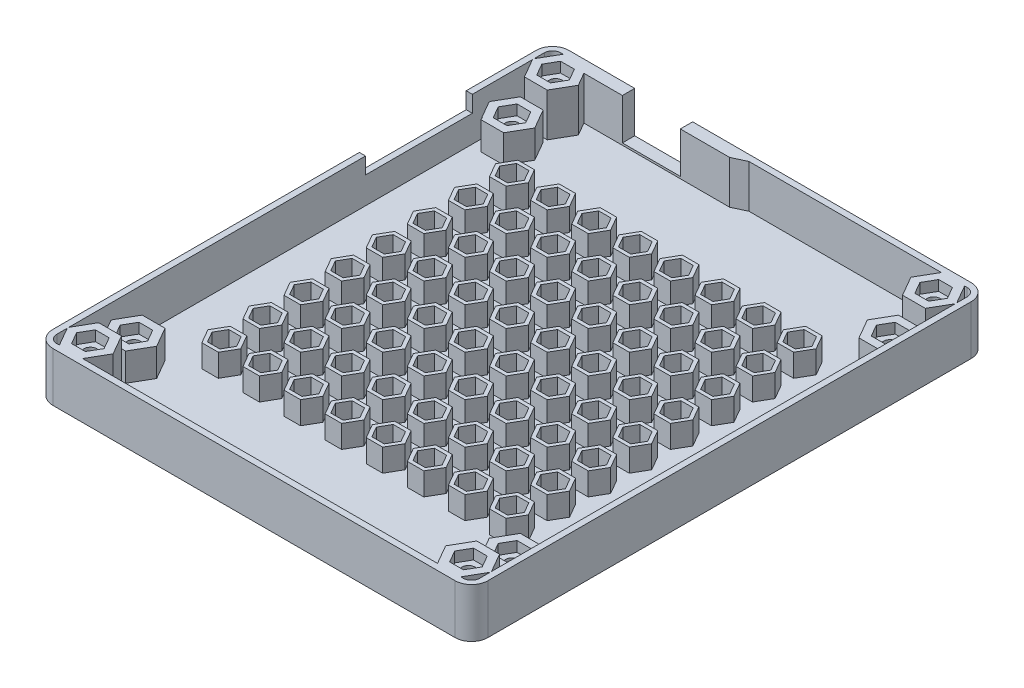
from build123d import *

# Parameters (mm, degrees)
P_IDAT_VYSUNUT_M25_DEPTH      = 3
P_IDAT_VYSUNUT_M26_DEPTH      = 10.5
P_IDAT_VYSUNUT_M26_DEPTH_BACK = 3
SKICA1_21_W                   = 105.885125168
SKICA1_21_H                   = 125.6
SKICA1_21_W_2                 = 102.885125168
SKICA1_21_H_2                 = 122.6
P_IDAT_VYSUNUT_M28_DEPTH      = 6.8
SKICA1_24_R                   = 1.6
P_IDAT_VYSUNUT_M29_DEPTH      = 4.3
LINPOLE3_COUNT                = 2
LINPOLE3_PITCH                = 92
LINPOLE3_COUNT_DIR2           = 2
LINPOLE3_PITCH_DIR2           = 92
P_IDAT_VYSUNUT_M30_DEPTH      = 10.5
SKICA1_26_R                   = 1.6
P_IDAT_VYSUNUT_M31_DEPTH      = 8
LINPOLE4_COUNT                = 2
LINPOLE4_PITCH                = 92
LINPOLE4_COUNT_DIR2           = 2
LINPOLE4_PITCH_DIR2           = 113.2
ZAOBLIT4_R                    = 4
SKICA9_W                      = 26
SKICA9_H                      = 4
ODEBRAT_VYSUNUT_M1_DEPTH      = 4
SKICA10_W                     = 14.1
SKICA10_H                     = 10
ODEBRAT_VYSUNUT_M2_DEPTH      = 5
P_IDAT_VYSUNUT_M32_DEPTH      = 5.5
LINPOLE5_COUNT                = 8
LINPOLE5_PITCH                = 10
LINPOLE5_COUNT_DIR2           = 8
LINPOLE5_PITCH_DIR2           = 10
SKICA12_W                     = 134.755212012
SKICA12_H                     = 11.049060792
ODEBRAT_VYSUNUT_M3_DEPTH      = 124.554642697
ZAOBLIT5_R                    = 2
P_IDAT_VYSUNUT_M33_DEPTH      = 1.5
P_IDAT_VYSUNUT_M34_REACH      = 85.011


with BuildPart() as part:
    # Skica1 → Přidat vysunutím25 (new body)
    with BuildSketch(Plane(origin=(0, 0, 0), x_dir=(1, 0, 0), z_dir=(0, 1, 0))):
        Polygon((51.442562584, 61.3), (-43.170983681, 61.3), (-43.228718708, 61.4), (-48.771281292, 61.4), (-48.829016319, 61.3), (-51.442562584, 61.3), (-51.442562584, 56.773205081), (-51.542562584, 56.6), (-51.442562584, 56.426794919), (-51.442562584, 46.173205081), (-51.542562584, 46), (-51.442562584, 45.826794919), (-51.442562584, -61.3), (51.442562584, -61.3), align=None)
    extrude(amount=-P_IDAT_VYSUNUT_M25_DEPTH)

    # Skica1<21> → Přidat vysunutím26 (add, two sides: drawn at the far end of the back side and taken through both)
    with BuildSketch(Plane(origin=(0, 0, 0), x_dir=(1, 0, 0), z_dir=(0, 1, 0)).offset(-P_IDAT_VYSUNUT_M26_DEPTH_BACK)):
        Rectangle(SKICA1_21_W, SKICA1_21_H)
        Rectangle(SKICA1_21_W_2, SKICA1_21_H_2, mode=Mode.SUBTRACT)
    extrude(amount=P_IDAT_VYSUNUT_M26_DEPTH + P_IDAT_VYSUNUT_M26_DEPTH_BACK)

    # Skica1<23> → Přidat vysunutím28 (add)
    with BuildSketch(Plane(origin=(0, 0, 0), x_dir=(1, 0, 0), z_dir=(0, 1, 0))):
        Polygon((-48.771281292, 41.2), (-43.228718708, 41.2), (-40.457437416, 46), (-43.228718708, 50.8), (-48.771281292, 50.8), (-51.542562584, 46), align=None)
        Polygon((-44.325684219, 43.1), (-47.674315781, 43.1), (-49.348631561, 46), (-47.674315781, 48.9), (-44.325684219, 48.9), (-42.651368439, 46), align=None, mode=Mode.SUBTRACT)
    p_idat_vysunut_m28 = extrude(amount=P_IDAT_VYSUNUT_M28_DEPTH)

    # Skica1<24> → Přidat vysunutím29 (add)
    with BuildSketch(Plane(origin=(0, 0, 0), x_dir=(1, 0, 0), z_dir=(0, 1, 0))):
        Polygon((-49.348631561, 46), (-47.674315781, 43.1), (-44.325684219, 43.1), (-42.651368439, 46), (-44.325684219, 48.9), (-47.674315781, 48.9), align=None)
        with Locations((-46, 46)):
            Circle(SKICA1_24_R, mode=Mode.SUBTRACT)
    p_idat_vysunut_m29 = extrude(amount=P_IDAT_VYSUNUT_M29_DEPTH)

    # LinPole3: Přidat vysunutím28, P_idat vysunut_m29 2 × 2
    with Locations(*[(i * LINPOLE3_PITCH, 0, j * LINPOLE3_PITCH_DIR2) for i in range(LINPOLE3_COUNT) for j in range(LINPOLE3_COUNT_DIR2) if (i, j) != (0, 0)]):
        add(p_idat_vysunut_m28)
        add(p_idat_vysunut_m29)

    # Skica1<25> → Přidat vysunutím30 (add)
    with BuildSketch(Plane(origin=(0, 0, 0), x_dir=(1, 0, 0), z_dir=(0, 1, 0))):
        Polygon((-51.542562584, 56.6), (-48.771281292, 51.8), (-43.228718708, 51.8), (-40.457437416, 56.6), (-43.228718708, 61.4), (-48.771281292, 61.4), align=None)
        Polygon((-44.325684219, 59.5), (-42.651368439, 56.6), (-44.325684219, 53.7), (-47.674315781, 53.7), (-49.348631561, 56.6), (-47.674315781, 59.5), align=None, mode=Mode.SUBTRACT)
    p_idat_vysunut_m30 = extrude(amount=P_IDAT_VYSUNUT_M30_DEPTH)

    # Skica1<26> → Přidat vysunutím31 (add)
    with BuildSketch(Plane(origin=(0, 0, 0), x_dir=(1, 0, 0), z_dir=(0, 1, 0))):
        Polygon((-44.325684219, 53.7), (-42.651368439, 56.6), (-44.325684219, 59.5), (-47.674315781, 59.5), (-49.348631561, 56.6), (-47.674315781, 53.7), align=None)
        with Locations((-46, 56.6)):
            Circle(SKICA1_26_R, mode=Mode.SUBTRACT)
    p_idat_vysunut_m31 = extrude(amount=P_IDAT_VYSUNUT_M31_DEPTH)

    # LinPole4: Přidat vysunutím30, P_idat vysunut_m31 2 × 2
    with Locations(*[(i * LINPOLE4_PITCH, 0, j * LINPOLE4_PITCH_DIR2) for i in range(LINPOLE4_COUNT) for j in range(LINPOLE4_COUNT_DIR2) if (i, j) != (0, 0)]):
        add(p_idat_vysunut_m30)
        add(p_idat_vysunut_m31)

    # Zaoblit4
    zaoblit4_edges = [part.edges().sort_by_distance(p)[0] for p in [
        (-52.942562584, 3.75, 62.8),
        (52.942562584, 3.75, 62.8),
        (52.942562584, 3.75, -62.8),
        (-52.942562584, 3.75, -62.8),
    ]]
    fillet(zaoblit4_edges, radius=ZAOBLIT4_R)

    # Skica9 → Odebrat vysunutím1 (cut)
    with BuildSketch(Plane.ZY.offset(52.942562584)):
        with Locations((-28.8, 8.5)):
            Rectangle(SKICA9_W, SKICA9_H)
    extrude(amount=-ODEBRAT_VYSUNUT_M1_DEPTH, mode=Mode.SUBTRACT)

    # Skica10 → Odebrat vysunutím2 (cut)
    with BuildSketch(Plane(origin=(0, 0, -62.8), x_dir=(-1, 0, 0), z_dir=(0, 0, -1))):
        with Locations((25.892562584, 5.5)):
            Rectangle(SKICA10_W, SKICA10_H)
    extrude(amount=-ODEBRAT_VYSUNUT_M2_DEPTH, mode=Mode.SUBTRACT)

    # Skica11 → Přidat vysunutím32 (add)
    with BuildSketch(Plane(origin=(0, 0, 0), x_dir=(1, 0, 0), z_dir=(0, 1, 0))):
        Polygon((-33, 31.535898385), (-31, 35), (-33, 38.464101615), (-37, 38.464101615), (-39, 35), (-37, 31.535898385), align=None)
        Polygon((-33.5, 32.401923789), (-32, 35), (-33.5, 37.598076211), (-36.5, 37.598076211), (-38, 35), (-36.5, 32.401923789), align=None, mode=Mode.SUBTRACT)
    p_idat_vysunut_m32 = extrude(amount=P_IDAT_VYSUNUT_M32_DEPTH)

    # LinPole5: P_idat vysunut_m32 8 × 8
    with Locations(*[(i * LINPOLE5_PITCH, 0, j * LINPOLE5_PITCH_DIR2) for i in range(LINPOLE5_COUNT) for j in range(LINPOLE5_COUNT_DIR2) if (i, j) != (0, 0)]):
        add(p_idat_vysunut_m32)

    # Skica12 → Odebrat vysunutím3 (cut, through all)
    with BuildSketch(Plane(origin=(52.942562584, 0, 0), x_dir=(0, 0, -1), z_dir=(1, 0, 0))):
        with Locations((-0.774482054, -7.024530396)):
            Rectangle(SKICA12_W, SKICA12_H)
    extrude(amount=-ODEBRAT_VYSUNUT_M3_DEPTH, mode=Mode.SUBTRACT)

    # Zaoblit5
    zaoblit5_edges = [part.edges().sort_by_distance(p)[0] for p in [
        (-51.442562584, 5.25, 61.3),
        (51.442562584, 5.25, 61.3),
        (51.442562584, 5.25, -61.3),
        (-51.442562584, 5.25, -61.3),
    ]]
    fillet(zaoblit5_edges, radius=ZAOBLIT5_R)

    # Skica13 → Přidat vysunutím33 (add)
    with BuildSketch(Plane.XY.offset(-61.3)):
        Polygon((-32.942562584, 10.5), (-43.942562584, 10.5), (-43.942562584, 0), (-6.842562584, 0), (-6.842562584, 10.5), (-18.842562584, 10.5), (-18.842562584, 0.5), (-32.942562584, 0.5), align=None)
    extrude(amount=P_IDAT_VYSUNUT_M33_DEPTH)

    # Skica14 → Přidat vysunutím34 (add, up to next)
    with BuildSketch(Plane(origin=(0, 10.5, 0), x_dir=(1, 0, 0), z_dir=(0, 1, 0)), mode=Mode.PRIVATE) as p_idat_vysunut_m34_sk1:
        Polygon((-6.842562584, 59.8), (-6.842562584, 61.3), (-3.625802203, 61.3), align=None)
    p_idat_vysunut_m34_tool1 = extrude(p_idat_vysunut_m34_sk1.sketch, amount=-P_IDAT_VYSUNUT_M34_REACH, mode=Mode.PRIVATE) - part.part
    add(p_idat_vysunut_m34_tool1.solids().sort_by_distance((-5.770309, 10.5, -60.8))[0])


solid = part.part
